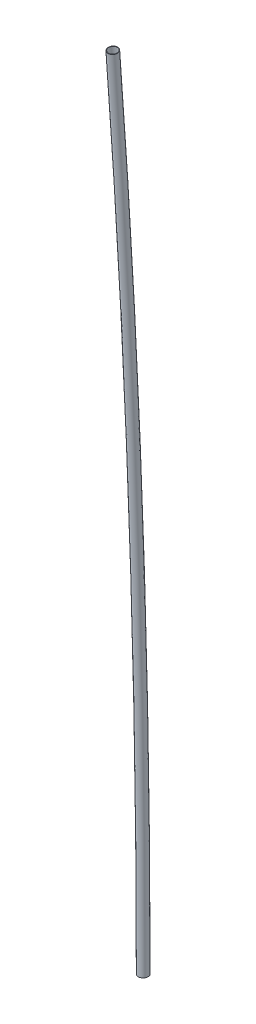
from build123d import *

# Parameters (mm, degrees)
SKETCH_1_R   = 40
SKETCH_1_R_2 = 37


with BuildPart() as part:
    # По траектории-Тонкостенный1: sweep along a path in Эскиз3
    with BuildLine(Plane(origin=(0, 0, 0), x_dir=(0, 0, -1), z_dir=(1, 0, 0))) as sweep_1_path:
        ThreePointArc((0, 0), (-62.521739436, 3352.331278379), (-250, 6700))
    # Эскиз1 → По траектории-Тонкостенный1 (sweep)
    with BuildSketch(Plane(origin=(0, 0, 0), x_dir=(1, 0, 0), z_dir=(0, 1, 0))):
        Circle(SKETCH_1_R)
        Circle(SKETCH_1_R_2, mode=Mode.SUBTRACT)
    sweep(path=sweep_1_path.line)


solid = part.part
